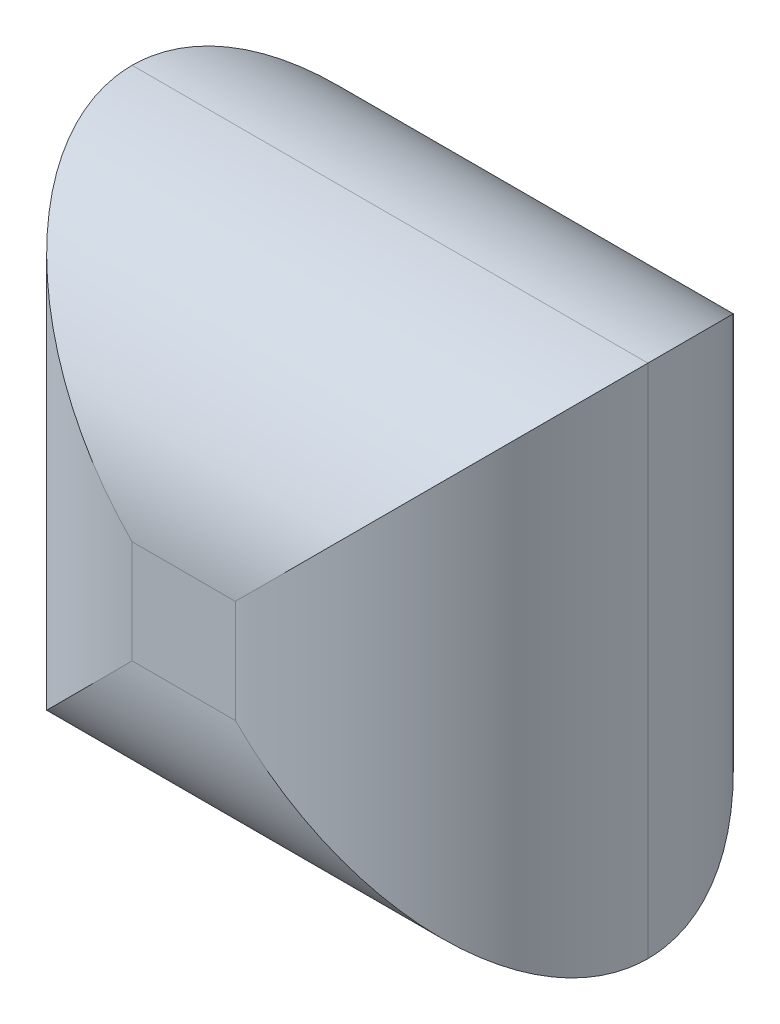
from build123d import *

# Parameters (mm, degrees)
SKETCH1_W           = 125
SKETCH1_H           = 125
BOSS_EXTRUDE1_DEPTH = 100
FILLET1_R           = 50


with BuildPart() as part:
    # Sketch1 → Boss-Extrude1 (new body)
    with BuildSketch(Plane.XY):
        with Locations((62.5, 62.5)):
            Rectangle(SKETCH1_W, SKETCH1_H)
    extrude(amount=BOSS_EXTRUDE1_DEPTH)

    # Fillet1
    fillet1_edges = [part.edges().sort_by_distance(p)[0] for p in [
        (62.5, 0, 0),
        (125, 62.5, 0),
        (62.5, 125, 0),
        (0, 62.5, 0),
        (62.5, 125, 100),
        (125, 62.5, 100),
        (62.5, 0, 100),
        (0, 62.5, 100),
    ]]
    fillet(fillet1_edges, radius=FILLET1_R - 0.0001)  # a hair under: the kernel refuses the full size


solid = part.part
